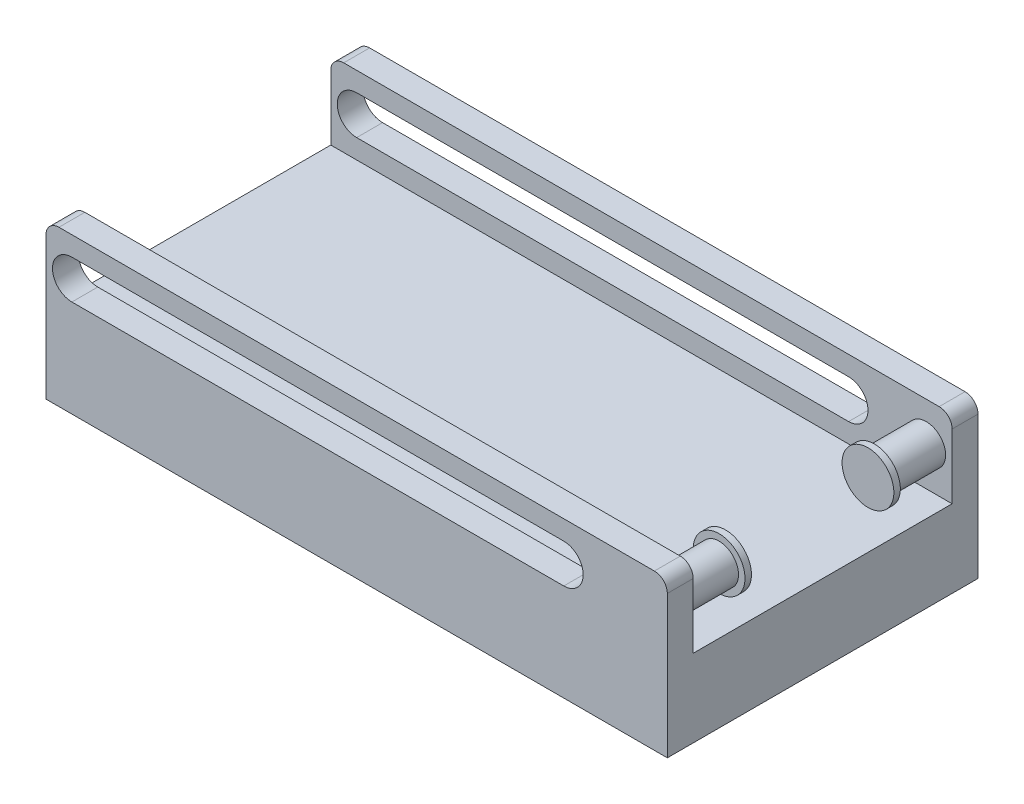
from build123d import *

# Parameters (mm, degrees)
SKETCH1_W             = 609.6
SKETCH1_H             = 304.8
BOSS_EXTRUDE1_DEPTH   = 76.2
SKETCH2_W             = 533.4
SKETCH2_H             = 25.4
BOSS_EXTRUDE2_DEPTH   = 76.2
CUT_EXTRUDE1_DEPTH    = 688.678907631
SKETCH4_W             = 25.4
SKETCH4_H             = 76.2
BOSS_EXTRUDE3_DEPTH   = 76.2
SKETCH5_R             = 19.05
BOSS_EXTRUDE4_DEPTH   = 50.8
SKETCH6_R             = 25.4
BOSS_EXTRUDE7_DEPTH   = 6.35
FILLET1_R             = 12.7
MIRROR1_START         = -304.8
MIRROR1_DEPTH         = 25.4
MIRROR1_START_2       = -279.4
MIRROR1_2_OUTLINE_R   = 19.05
MIRROR1_2_DEPTH       = 57.15
MIRROR1_START_3       = -228.6
MIRROR1_3_OUTLINE_R   = 25.4
MIRROR1_3_OUTLINE_R_2 = 19.05
MIRROR1_3_DEPTH       = 6.35


# Read off the part's stored shape, not the designer's step: Mirror1
with BuildPart() as part:
    # Sketch1 → Boss-Extrude1 (new body)
    with BuildSketch(Plane(origin=(0, 0, 0), x_dir=(1, 0, 0), z_dir=(0, 1, 0))):
        with Locations((304.8, 152.4)):
            Rectangle(SKETCH1_W, SKETCH1_H)
    extrude(amount=BOSS_EXTRUDE1_DEPTH)

    # Sketch2 → Boss-Extrude2 (add)
    with BuildSketch(Plane(origin=(0, 76.2, 0), x_dir=(1, 0, 0), z_dir=(0, 1, 0))):
        with Locations((266.7, 12.7)):
            Rectangle(SKETCH2_W, SKETCH2_H)
    extrude(amount=BOSS_EXTRUDE2_DEPTH)

    # Sketch3 → Cut-Extrude1 (cut, through all)
    with BuildSketch(Plane(origin=(0, 0, -25.4), x_dir=(-1, 0, 0), z_dir=(0, 0, -1))):
        with BuildLine():
            Line((-508, 133.35), (-25.4, 133.35))
            ThreePointArc((-25.4, 133.35), (-6.35, 114.3), (-25.4, 95.25))
            Line((-25.4, 95.25), (-508, 95.25))
            ThreePointArc((-508, 95.25), (-527.05, 114.3), (-508, 133.35))
        make_face()
    extrude(amount=-CUT_EXTRUDE1_DEPTH, mode=Mode.SUBTRACT)

    # Sketch4 → Boss-Extrude3 (add, through all)
    with BuildSketch(Plane(origin=(533.4, 0, 0), x_dir=(0, 0, -1), z_dir=(1, 0, 0))):
        with Locations((12.7, 114.3)):
            Rectangle(SKETCH4_W, SKETCH4_H)
    extrude(amount=BOSS_EXTRUDE3_DEPTH)

    # Sketch5 → Boss-Extrude4 (add)
    with BuildSketch(Plane.XY.offset(-25.4)):
        with Locations((584.2, 114.3)):
            Circle(SKETCH5_R)
    extrude(amount=-BOSS_EXTRUDE4_DEPTH)

    # Sketch6 → Boss-Extrude7 (add)
    with BuildSketch(Plane(origin=(0, 0, -76.2), x_dir=(-1, 0, 0), z_dir=(0, 0, -1))):
        with Locations((-584.2, 114.3)):
            Circle(SKETCH6_R)
    extrude(amount=BOSS_EXTRUDE7_DEPTH)

    # Fillet1
    fillet1_edges = [part.edges().sort_by_distance(p)[0] for p in [
        (0, 152.4, -12.7),
        (609.6, 152.4, -12.7),
    ]]
    fillet(fillet1_edges, radius=FILLET1_R)

    # Mirror1 outline → Mirror1 (add)
    with BuildSketch(Plane.XY.offset(MIRROR1_START)):
        with BuildLine():
            Line((596.9, 152.4), (12.7, 152.4))
            ThreePointArc((12.7, 152.4), (3.719743879, 148.680256121), (0, 139.7))
            Line((0, 139.7), (0, 76.2))
            Line((0, 76.2), (609.6, 76.2))
            Line((609.6, 76.2), (609.6, 139.7))
            ThreePointArc((609.6, 139.7), (605.880256121, 148.680256121), (596.9, 152.4))
        make_face()
        with BuildLine():
            ThreePointArc((508, 133.35), (527.05, 114.3), (508, 95.25))
            Line((508, 95.25), (25.4, 95.25))
            ThreePointArc((25.4, 95.25), (6.35, 114.3), (25.4, 133.35))
            Line((25.4, 133.35), (508, 133.35))
        make_face(mode=Mode.SUBTRACT)
    extrude(amount=MIRROR1_DEPTH)

    # Mirror1 2 outline → Mirror1 2 (add)
    with BuildSketch(Plane.XY.offset(MIRROR1_START_2)):
        with Locations((584.2, 114.3)):
            Circle(MIRROR1_2_OUTLINE_R)
    extrude(amount=MIRROR1_2_DEPTH)

    # Mirror1 3 outline → Mirror1 3 (add)
    with BuildSketch(Plane.XY.offset(MIRROR1_START_3)):
        with Locations((584.2, 114.3)):
            Circle(MIRROR1_3_OUTLINE_R)
        with Locations((584.2, 114.3)):
            Circle(MIRROR1_3_OUTLINE_R_2, mode=Mode.SUBTRACT)
    extrude(amount=MIRROR1_3_DEPTH)


solid = part.part
